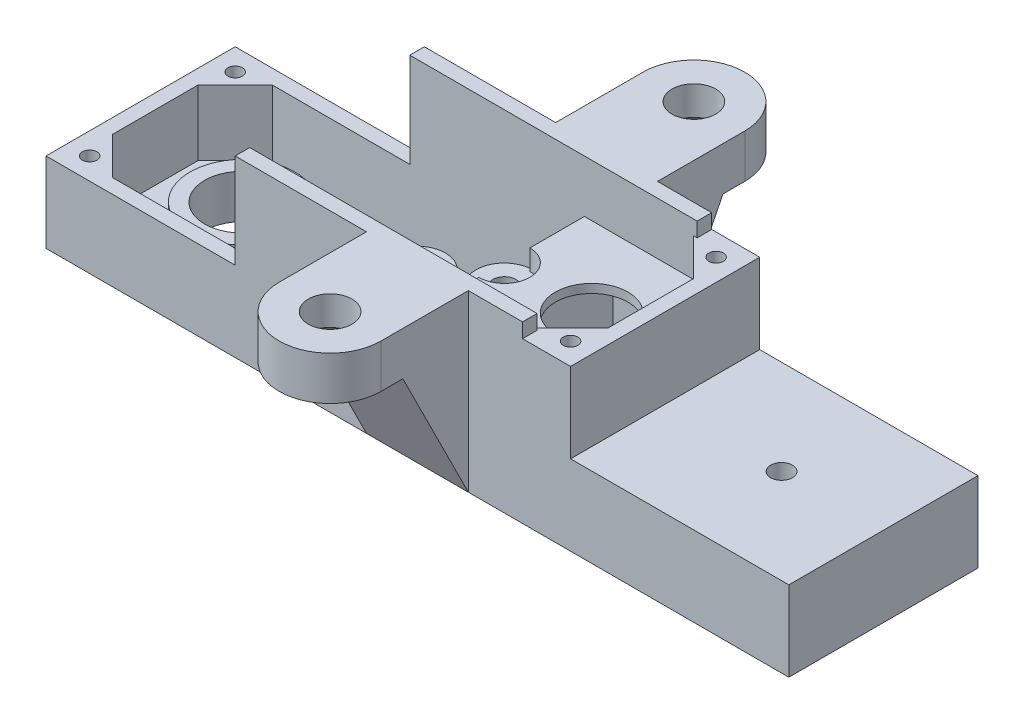
from build123d import *
from build123d.topology import SkipClean

# Parameters (mm, degrees)
ESQUISSE2_W                 = 36.05
ESQUISSE2_H                 = 13
ESQUISSE2_W_2               = 34.05
ESQUISSE2_H_2               = 11
BOSS_EXTRU_1_DEPTH          = 12
ESQUISSE3_W                 = 13
ESQUISSE3_H                 = 1
BOSS_EXTRU_2_DEPTH          = 36.05
ESQUISSE4_R                 = 2.6
ENL_V_MAT_EXTRU_1_DEPTH     = 12
ESQUISSE6_W                 = 3.9
ESQUISSE6_H                 = 1.5
ESQUISSE6_H_2               = 5
ESQUISSE6_H_3               = 7
BOSS_EXTRU_3_DEPTH          = 13
ENL_V_START                 = -6
ENL_V_MAT_EXTRU_2_OUTLINE_R = 0.8
ENL_V_MAT_EXTRU_2_DEPTH     = 6
ESQUISSE8_W                 = 13
ESQUISSE8_H                 = 6.5
ENL_V_MAT_EXTRU_3_DEPTH     = 40.261972696
ESQUISSE9_W                 = 8.1
ESQUISSE9_H                 = 11
BOSS_EXTRU_5_DEPTH          = 1.4
ESQUISSE11_R                = 2.5
ENL_V_MAT_EXTRU_4_DEPTH     = 38.987662471
CONG_2_R                    = 2
ESQUISSE10_W                = 8.1
ESQUISSE10_H                = 11
ENL_V_MAT_EXTRU_5_DEPTH     = 0.8
BOSS_EXTRU_6_DEPTH          = 2.6
ESQUISSE14_R                = 0.5
ENL_V_MAT_EXTRU_7_DEPTH     = 39.645860063
ESQUISSE15_R                = 0.8
ENL_V_MAT_EXTRU_8_DEPTH     = 38.702818197
ESQUISSE16_W                = 3.3
ESQUISSE16_H                = 13
ENL_V_MAT_EXTRU_9_DEPTH     = 1
CHANFREIN1_SIZE             = 0.5
ESQUISSE18_W                = 15
ESQUISSE18_H                = 13
ESQUISSE18_R                = 0.75
BOSS_EXTRU_9_DEPTH          = 5.5
ESQUISSE19_R                = 1.5
BOSS_EXTRU_10_DEPTH         = 12
ENL_V_MAT_EXTRU_10_DEPTH    = 39.061800076
ESQUISSE23_R                = 3.6
ESQUISSE23_R_2              = 2.6
BOSS_EXTRU_11_DEPTH         = 2


# Read off the part's stored shape, not the designer's step: Enlèv. mat.-Extru.2
with BuildPart() as part:
    # Esquisse2 → Boss.-Extru.1 (new body)
    # profile 1 of 3: a face of its own
    with BuildSketch(Plane(origin=(0, 0, 0), x_dir=(1, 0, 0), z_dir=(0, 1, 0))):
        with Locations((17.025, 5.5)):
            Rectangle(ESQUISSE2_W, ESQUISSE2_H)
        with Locations((17.025, 5.5)):
            Rectangle(ESQUISSE2_W_2, ESQUISSE2_H_2, mode=Mode.SUBTRACT)
    # profile 2 of 3: a face of its own
    with BuildSketch(Plane(origin=(0, 0, 0), x_dir=(1, 0, 0), z_dir=(0, 1, 0))):
        Polygon((0, 0), (2.560660172, 0), (0, 2.560660172), align=None)
    # profile 3 of 3: a face of its own
    with BuildSketch(Plane(origin=(0, 0, 0), x_dir=(1, 0, 0), z_dir=(0, 1, 0))):
        Polygon((0, 11), (0, 8.439339828), (2.560660172, 11), align=None)
    extrude(amount=BOSS_EXTRU_1_DEPTH)

    # Esquisse3 → Boss.-Extru.2 (add)
    with BuildSketch(Plane.ZY.offset(1)):
        with Locations((-5.5, 0.5)):
            Rectangle(ESQUISSE3_W, ESQUISSE3_H)
    extrude(amount=-BOSS_EXTRU_2_DEPTH)

    # Esquisse4 → Enlèv. mat.-Extru.1 (cut)
    with BuildSketch(Plane.XZ):
        with Locations(Location((6, -5.5, 0), (0, 0, 270))):
            Circle(ESQUISSE4_R)
        Polygon((34.05, 0), (28.45, 0), (25.95, -2.5), (25.95, -8.5), (28.45, -11), (34.05, -11), align=None)
    extrude(amount=-ENL_V_MAT_EXTRU_1_DEPTH, mode=Mode.SUBTRACT)

    # Esquisse6 → Boss.-Extru.3 (add)
    with BuildSketch(Plane.XY.offset(1)):
        with Locations((12, 0.75)):
            Rectangle(ESQUISSE6_W, ESQUISSE6_H)
        with Locations((18, 2.5)):
            Rectangle(ESQUISSE6_W, ESQUISSE6_H_2)
        with Locations((24, 3.5)):
            Rectangle(ESQUISSE6_W, ESQUISSE6_H_3)
    extrude(amount=-BOSS_EXTRU_3_DEPTH)

    # Enlèv. mat.-Extru.2 outline → Enlèv. mat.-Extru.2 (cut)
    with BuildSketch(Plane(origin=(0, 7, 0), x_dir=(1, 0, 0), z_dir=(0, 1, 0)).offset(ENL_V_START)):
        with BuildLine():
            Line((24, 7.45), (24, 11))
            Line((24, 11), (22.05, 11))
            Line((22.05, 11), (22.05, 5.5))
            ThreePointArc((22.05, 5.5), (22.621141777, 6.878858223), (24, 7.45))
        make_face()
        with BuildLine():
            Line((19.95, 5.5), (19.95, 11))
            Line((19.95, 11), (16.05, 11))
            Line((16.05, 11), (16.05, 5.5))
            ThreePointArc((16.05, 5.5), (18, 7.45), (19.95, 5.5))
        make_face()
        with BuildLine():
            ThreePointArc((24, 3.55), (22.621141777, 4.121141777), (22.05, 5.5))
            Line((22.05, 5.5), (22.05, 0))
            Line((22.05, 0), (24, 0))
            Line((24, 0), (24, 3.55))
        make_face()
        with BuildLine():
            Line((19.95, 0), (19.95, 5.5))
            ThreePointArc((19.95, 5.5), (18, 3.55), (16.05, 5.5))
            Line((16.05, 5.5), (16.05, 0))
            Line((16.05, 0), (19.95, 0))
        make_face()
        with BuildLine():
            Line((13.95, 5.5), (13.95, 11))
            Line((13.95, 11), (10.05, 11))
            Line((10.05, 11), (10.05, 5.5))
            ThreePointArc((10.05, 5.5), (12, 7.45), (13.95, 5.5))
        make_face()
        with BuildLine():
            Line((13.95, 0), (13.95, 5.5))
            ThreePointArc((13.95, 5.5), (12, 3.55), (10.05, 5.5))
            Line((10.05, 5.5), (10.05, 0))
            Line((10.05, 0), (13.95, 0))
        make_face()
        with Locations((24, 5.5)):
            Circle(ENL_V_MAT_EXTRU_2_OUTLINE_R)
        with Locations((18, 5.5)):
            Circle(ENL_V_MAT_EXTRU_2_OUTLINE_R)
        with Locations((12, 5.5)):
            Circle(ENL_V_MAT_EXTRU_2_OUTLINE_R)
    extrude(amount=ENL_V_MAT_EXTRU_2_DEPTH, mode=Mode.SUBTRACT)

    # Esquisse8 → Enlèv. mat.-Extru.3 (cut, through all)
    with BuildSketch(Plane(origin=(0, 0, -12), x_dir=(-1, 0, 0), z_dir=(0, 0, -1))):
        with Locations((-5.5, 8.75)):
            Rectangle(ESQUISSE8_W, ESQUISSE8_H)
    extrude(amount=-ENL_V_MAT_EXTRU_3_DEPTH, mode=Mode.SUBTRACT)

    # Esquisse9 → Boss.-Extru.5 (add)
    with BuildSketch(Plane(origin=(0, 7, 0), x_dir=(1, 0, 0), z_dir=(0, 1, 0))):
        with Locations((30, 5.5)):
            Rectangle(ESQUISSE9_W, ESQUISSE9_H)
        with BuildLine():
            Line((24, 0), (25.95, 0))
            Line((25.95, 0), (25.95, 11))
            Line((25.95, 11), (24, 11))
            Line((24, 11), (24, 7.45))
            Line((24, 7.45), (24, 7.25))
            ThreePointArc((24, 7.25), (25.237436867, 6.737436867), (25.75, 5.5))
            ThreePointArc((25.75, 5.5), (25.237436867, 4.262563133), (24, 3.75))
            Line((24, 3.75), (24, 3.55))
            Line((24, 3.55), (24, 0))
        make_face()
    extrude(amount=BOSS_EXTRU_5_DEPTH)

    # Esquisse11 → Enlèv. mat.-Extru.4 (cut, through all)
    with BuildSketch(Plane(origin=(0, 8.4, 0), x_dir=(1, 0, 0), z_dir=(0, 1, 0))):
        with Locations(Location((30, 5.5, 0), (0, 0, 180))):
            Circle(ESQUISSE11_R)
    extrude(amount=-ENL_V_MAT_EXTRU_4_DEPTH, mode=Mode.SUBTRACT)

    # Congé2
    # the kernel refuses this fillet: 2 mm, written as the material it adds along each edge
    with BuildSketch(Plane(origin=(12, 1, -5.5), x_dir=(-1, 0, 0), z_dir=(0, 0, 1))) as cong_2_piece_1:
        with BuildLine():
            CenterArc((3.272875656, -2), CONG_2_R, 90, 41.409622109)
            Line((1.95, -0.5), (1.95, 0))
            Line((1.95, 0), (3.272875656, 0))
        make_face()
    revolve(axis=Axis((12, 1, -5.5), (0, -1, 0)))
    with BuildSketch(Plane(origin=(18, 1, -5.5), x_dir=(-1, 0, 0), z_dir=(0, 0, 1))) as cong_2_piece_2:
        with BuildLine():
            CenterArc((1.95 + CONG_2_R, -CONG_2_R), CONG_2_R, 90, 90)
            Line((1.95, -CONG_2_R), (1.95, 0))
            Line((1.95, 0), (1.95 + CONG_2_R, 0))
        make_face()
    revolve(axis=Axis((18, 1, -5.5), (0, -1, 0)))
    with BuildSketch(Plane(origin=(24.000000001, 1, -5.500000001), x_dir=(-5.493679582300461e-10, 0, 1.0), z_dir=(1.0, 0, 5.493679582300461e-10))) as cong_2_piece_3:
        with BuildLine():
            CenterArc((1.950000001 + CONG_2_R, -CONG_2_R), CONG_2_R, 90, 90)
            Line((1.950000001, -CONG_2_R), (1.950000001, 0))
            Line((1.950000001, 0), (1.950000001 + CONG_2_R, 0))
        make_face()
    revolve(axis=Axis((24.000000001, 1, -5.500000001), (0, -1, 0)), revolution_arc=89.999999937)
    with BuildSketch(Plane(origin=(24.000000001, 1, -5.499999999), x_dir=(-1.0, 0, -5.49367047277821e-10), z_dir=(-5.49367047277821e-10, 0, 1.0))) as cong_2_piece_4:
        with BuildLine():
            CenterArc((1.950000001 + CONG_2_R, -CONG_2_R), CONG_2_R, 90, 90)
            Line((1.950000001, -CONG_2_R), (1.950000001, 0))
            Line((1.950000001, 0), (1.950000001 + CONG_2_R, 0))
        make_face()
    revolve(axis=Axis((24.000000001, 1, -5.499999999), (0, -1, 0)), revolution_arc=89.999999937)

    # Esquisse10 → Enlèv. mat.-Extru.5 (cut)
    with BuildSketch(Plane.XZ.offset(-7)):
        with Locations((30, -5.5)):
            Rectangle(ESQUISSE10_W, ESQUISSE10_H)
    extrude(amount=-ENL_V_MAT_EXTRU_5_DEPTH, mode=Mode.SUBTRACT)

    # Esquisse13 → Boss.-Extru.6 (add)
    with BuildSketch(Plane(origin=(0, 8.4, 0), x_dir=(1, 0, 0), z_dir=(0, 1, 0))):
        Polygon((34.05, 2.560660172), (31.489339828, 0), (34.05, 0), align=None)
        Polygon((31.489339828, 11), (34.05, 8.439339828), (34.05, 11), align=None)
    extrude(amount=BOSS_EXTRU_6_DEPTH)

    # Esquisse14 → Enlèv. mat.-Extru.7 (cut, through all)
    with BuildSketch(Plane(origin=(0, 11, 0), x_dir=(1, 0, 0), z_dir=(0, 1, 0))):
        with Locations(Location((33.55, 0.5, 0), (0, 0, 270))):
            Circle(ESQUISSE14_R)
        with Locations((33.55, 10.5)):
            Circle(ESQUISSE14_R)
        with Locations(Location((0.5, 0.5, 0), (0, 0, 270))):
            Circle(ESQUISSE14_R)
        with Locations(Location((0.5, 10.5, 0), (0, 0, 270))):
            Circle(ESQUISSE14_R)
    extrude(amount=-ENL_V_MAT_EXTRU_7_DEPTH, mode=Mode.SUBTRACT)

    # Esquisse15 → Enlèv. mat.-Extru.8 (cut, through all)
    with SkipClean():  # the faces are left unmerged after this step: merging them gives an invalid solid
        with BuildSketch(Plane(origin=(0, 7, 0), x_dir=(1, 0, 0), z_dir=(0, 1, 0))):
            with Locations(Location((24, 5.5, 0), (0, 0, 180))):
                Circle(ESQUISSE15_R)
            with Locations(Location((18, 5.5, 0), (0, 0, 180))):
                Circle(ESQUISSE15_R)
            with Locations(Location((12, 5.5, 0), (0, 0, 180))):
                Circle(ESQUISSE15_R)
        extrude(amount=-ENL_V_MAT_EXTRU_8_DEPTH, mode=Mode.SUBTRACT)
    add(part.part.scale(1), mode=Mode.REPLACE)  # the faces are merged on a copy

    # Esquisse16 → Enlèv. mat.-Extru.9 (cut)
    with BuildSketch(Plane(origin=(0, 12, 0), x_dir=(1, 0, 0), z_dir=(0, 1, 0))):
        with Locations((33.4, 5.5)):
            Rectangle(ESQUISSE16_W, ESQUISSE16_H)
    extrude(amount=-ENL_V_MAT_EXTRU_9_DEPTH, mode=Mode.SUBTRACT)

    # Chanfrein1
    chanfrein1_edges = [part.edges().sort_by_distance(p)[0] for p in [
        (24.8, 0, -5.5),
    ]]
    chamfer(chanfrein1_edges, length=CHANFREIN1_SIZE)

    # Esquisse18 → Boss.-Extru.9 (add)
    with BuildSketch(Plane.XZ):
        with Locations((42.55, -5.5)):
            Rectangle(ESQUISSE18_W, ESQUISSE18_H)
        with Locations(Location((43.05, -5.5, 0), (0, 0, 270))):
            Circle(ESQUISSE18_R, mode=Mode.SUBTRACT)
    extrude(amount=-BOSS_EXTRU_9_DEPTH)

    # Esquisse19 → Boss.-Extru.10 (add)
    with BuildSketch(Plane(origin=(0, 12, 0), x_dir=(1, 0, 0), z_dir=(0, 1, 0))):
        with BuildLine():
            Line((28.025, 12), (21.025, 12))
            Line((21.025, 12), (21.025, 18))
            ThreePointArc((21.025, 18), (24.525, 21.5), (28.025, 18))
            Line((28.025, 18), (28.025, 12))
        make_face()
        with Locations(Location((24.525, 18, 0), (0, 0, 270))):
            Circle(ESQUISSE19_R, mode=Mode.SUBTRACT)
    boss_extru_10 = extrude(amount=-BOSS_EXTRU_10_DEPTH)

    # Esquisse21 → Enlèv. mat.-Extru.10 (cut, through all)
    with BuildSketch(Plane(origin=(28.025, 0, 0), x_dir=(0, 0, -1), z_dir=(1, 0, 0))):
        Polygon((12, 0), (16.5, 9), (21.5, 9), (21.5, 0), (16.5, 0), align=None)
    enl_v_mat_extru_10 = extrude(amount=-ENL_V_MAT_EXTRU_10_DEPTH, mode=Mode.SUBTRACT)

    # Esquisse22 → Enlèvement de matière-Révolution1 (revolve, cut)
    with BuildSketch(Plane(origin=(24.525, 0, 0), x_dir=(0, 0, -1), z_dir=(1, 0, 0))):
        Polygon((15.5, 7), (15.5, 9), (16.5, 10), (16.5, 9), (16.5, 7), align=None)
    enl_vement_de_mati_re_r_volution1 = revolve(axis=Axis((24.525, 9, -18), (0, 1, 0)), mode=Mode.SUBTRACT)

    # Symétrie1: Boss.-Extru.10, Enlèv. mat.-Extru.10, Enlèvement de matière-Révolution1 across plane
    add(boss_extru_10.mirror(Plane.XY.offset(-5.5)))
    add(enl_v_mat_extru_10.mirror(Plane.XY.offset(-5.5)), mode=Mode.SUBTRACT)
    add(enl_vement_de_mati_re_r_volution1.mirror(Plane.XY.offset(-5.5)), mode=Mode.SUBTRACT)

    # Esquisse23 → Boss.-Extru.11 (add)
    with BuildSketch(Plane(origin=(0, 1, 0), x_dir=(1, 0, 0), z_dir=(0, 1, 0))):
        with Locations(Location((6, 5.5, 0), (0, 0, 27.702053352))):
            Circle(ESQUISSE23_R)
        with Locations(Location((6, 5.5, 0), (0, 0, 90))):
            Circle(ESQUISSE23_R_2, mode=Mode.SUBTRACT)
    extrude(amount=BOSS_EXTRU_11_DEPTH)


solid = part.part
